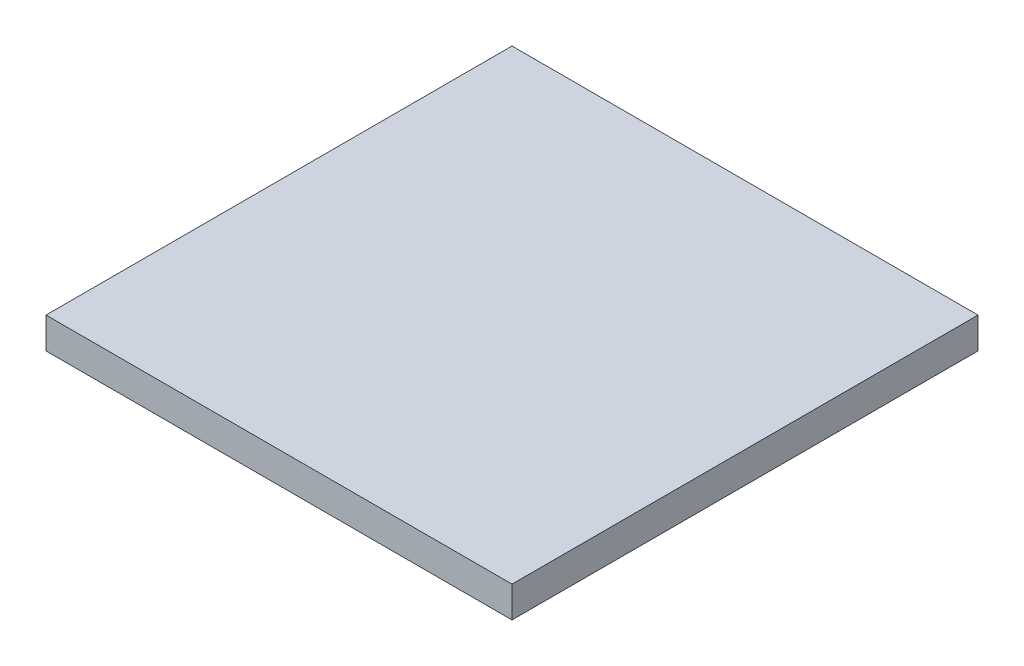
from build123d import *

# Parameters (mm, degrees)
SKETCH2_W           = 30
SKETCH2_H           = 30
BOSS_EXTRUDE1_DEPTH = 2


with BuildPart() as part:
    # Sketch2 → Boss-Extrude1 (new body)
    with BuildSketch(Plane(origin=(0, 0, 0), x_dir=(1, 0, 0), z_dir=(0, 1, 0))):
        Rectangle(SKETCH2_W, SKETCH2_H)
    extrude(amount=BOSS_EXTRUDE1_DEPTH)


solid = part.part
